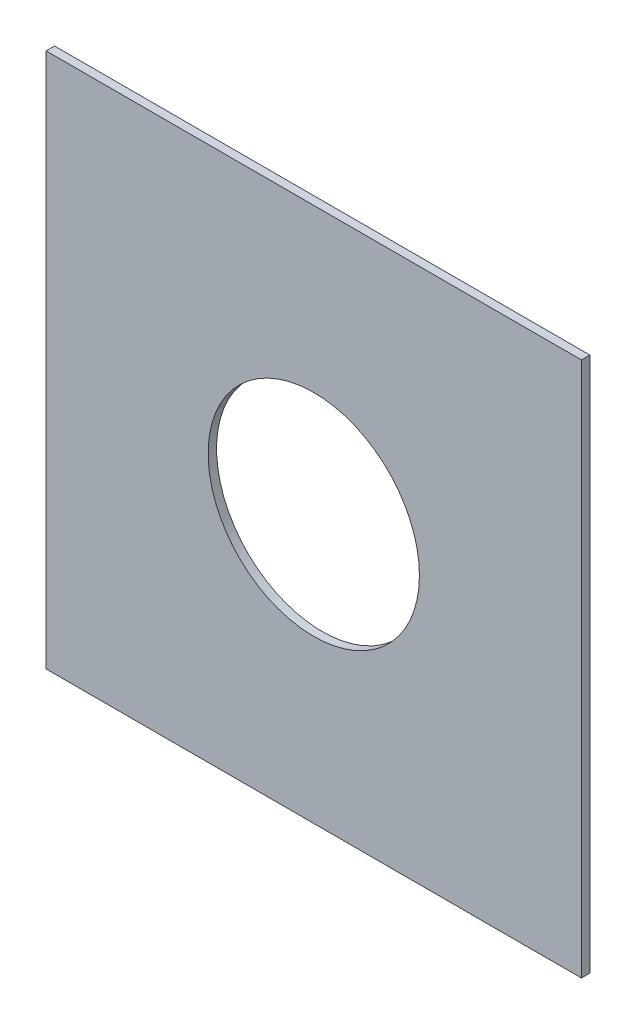
from build123d import *

# Parameters (mm, degrees)
SKETCH1_W        = 190
SKETCH1_H        = 190
SKETCH1_R        = 37.5
MAIN_PLATE_DEPTH = 3


# Sheet-metal steps are written as plain solids
with BuildPart() as part:
    # Sketch1 → Main Plate (new body)
    with BuildSketch(Plane.XY):
        Rectangle(SKETCH1_W, SKETCH1_H)
        Circle(SKETCH1_R, mode=Mode.SUBTRACT)
    extrude(amount=-MAIN_PLATE_DEPTH)


solid = part.part
